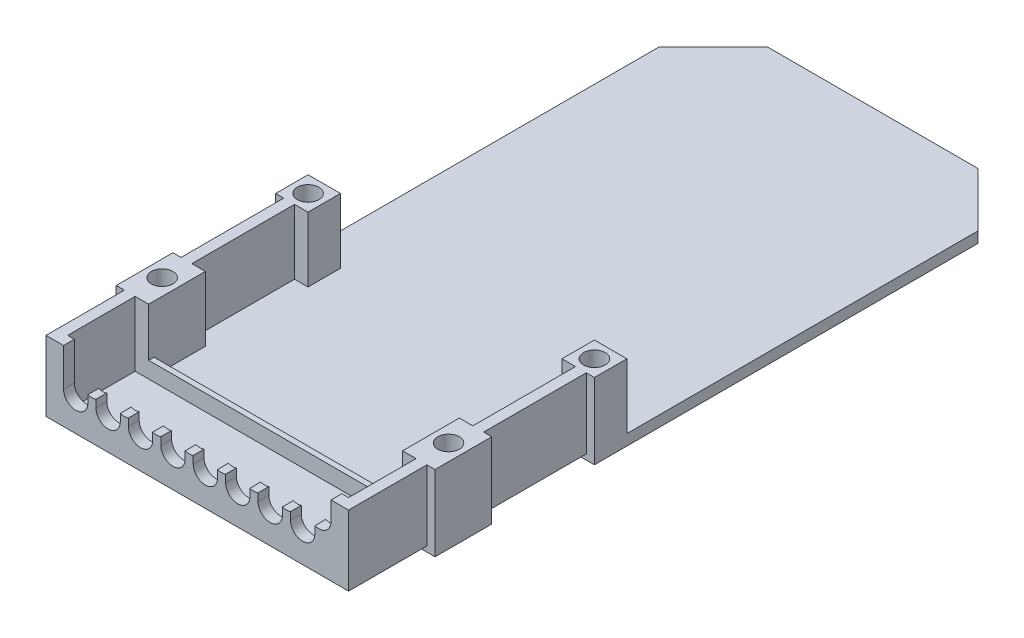
from build123d import *

# Parameters (mm, degrees)
SKETCH1_W            = 56
SKETCH1_H            = 25
BOSS_EXTRUDE1_DEPTH  = 2
SKETCH2_W            = 2
SKETCH2_H            = 25
BOSS_EXTRUDE2_DEPTH  = 12
SKETCH3_W            = 56
SKETCH3_H            = 2
BOSS_EXTRUDE3_DEPTH  = 25
SKETCH4_W            = 6
SKETCH4_H            = 12
BOSS_EXTRUDE4_DEPTH  = 2.5
SKETCH5_W            = 6
SKETCH5_H            = 12
BOSS_EXTRUDE5_DEPTH  = 2.5
SKETCH6_W            = 2
SKETCH6_H            = 12
BOSS_EXTRUDE6_DEPTH  = 25
SKETCH7_W            = 2
SKETCH7_H            = 12
BOSS_EXTRUDE7_DEPTH  = 25
SKETCH8_W            = 2
SKETCH8_H            = 12
BOSS_EXTRUDE8_DEPTH  = 2.5
SKETCH9_W            = 2
SKETCH9_H            = 12
BOSS_EXTRUDE9_DEPTH  = 2.5
SKETCH10_W           = 52
SKETCH10_H           = 1
BOSS_EXTRUDE10_DEPTH = 3
SKETCH11_W           = 52
SKETCH11_H           = 2
BOSS_EXTRUDE11_DEPTH = 12
CUT_EXTRUDE1_DEPTH   = 12
SKETCH13_W           = 6
SKETCH13_H           = 14
BOSS_EXTRUDE12_DEPTH = 1.5
SKETCH14_W           = 6
SKETCH14_H           = 14
BOSS_EXTRUDE13_DEPTH = 1.5
SKETCH15_R           = 2
CUT_EXTRUDE2_DEPTH   = 21.5
SKETCH16_R           = 2
CUT_EXTRUDE3_DEPTH   = 21.5
SKETCH17_W           = 8.5
SKETCH17_H           = 12
BOSS_EXTRUDE14_DEPTH = 2.5
SKETCH18_W           = 8.5
SKETCH18_H           = 12
BOSS_EXTRUDE15_DEPTH = 2.5
SKETCH19_W           = 10.5
SKETCH19_H           = 14
BOSS_EXTRUDE16_DEPTH = 1.5
SKETCH20_W           = 10.5
SKETCH20_H           = 14
BOSS_EXTRUDE17_DEPTH = 1.5
SKETCH21_R           = 2
CUT_EXTRUDE4_DEPTH   = 20
SKETCH22_R           = 2
CUT_EXTRUDE5_DEPTH   = 20
CHAMFER4_SIZE        = 1
SKETCH23_W           = 59
SKETCH23_H           = 2
BOSS_EXTRUDE18_DEPTH = 75
CHAMFER5_SIZE        = 10


with BuildPart() as part:
    # Sketch1 → Boss-Extrude1 (new body)
    with BuildSketch(Plane(origin=(0, 0, 0), x_dir=(1, 0, 0), z_dir=(0, 1, 0))):
        Rectangle(SKETCH1_W, SKETCH1_H)
    extrude(amount=BOSS_EXTRUDE1_DEPTH)

    # Sketch2 → Boss-Extrude2 (add)
    with BuildSketch(Plane(origin=(0, 2, 0), x_dir=(1, 0, 0), z_dir=(0, 1, 0))):
        with Locations((-27, 0)):
            Rectangle(SKETCH2_W, SKETCH2_H)
        with Locations((27, 0)):
            Rectangle(SKETCH2_W, SKETCH2_H)
    extrude(amount=BOSS_EXTRUDE2_DEPTH)

    # Sketch3 → Boss-Extrude3 (add)
    with BuildSketch(Plane.XY.offset(12.5)):
        with Locations((0, 1)):
            Rectangle(SKETCH3_W, SKETCH3_H)
    extrude(amount=BOSS_EXTRUDE3_DEPTH)

    # Sketch4 → Boss-Extrude4 (add)
    with BuildSketch(Plane(origin=(-26, 0, 0), x_dir=(0, 0, -1), z_dir=(1, 0, 0))):
        with Locations((9.5, 8)):
            Rectangle(SKETCH4_W, SKETCH4_H)
    extrude(amount=BOSS_EXTRUDE4_DEPTH)

    # Sketch5 → Boss-Extrude5 (add)
    with BuildSketch(Plane.ZY.offset(-26)):
        with Locations((-9.5, 8)):
            Rectangle(SKETCH5_W, SKETCH5_H)
    extrude(amount=BOSS_EXTRUDE5_DEPTH)

    # Sketch6 → Boss-Extrude6 (add)
    with BuildSketch(Plane.XY.offset(12.5)):
        with Locations((-27, 8)):
            Rectangle(SKETCH6_W, SKETCH6_H)
    extrude(amount=BOSS_EXTRUDE6_DEPTH)

    # Sketch7 → Boss-Extrude7 (add)
    with BuildSketch(Plane.XY.offset(12.5)):
        with Locations((27, 8)):
            Rectangle(SKETCH7_W, SKETCH7_H)
    extrude(amount=BOSS_EXTRUDE7_DEPTH)

    # Sketch8 → Boss-Extrude8 (add)
    with BuildSketch(Plane(origin=(-26, 0, 0), x_dir=(0, 0, -1), z_dir=(1, 0, 0))):
        with Locations((-13.5, 8)):
            Rectangle(SKETCH8_W, SKETCH8_H)
    extrude(amount=BOSS_EXTRUDE8_DEPTH)

    # Sketch9 → Boss-Extrude9 (add)
    with BuildSketch(Plane.ZY.offset(-26)):
        with Locations((13.5, 8)):
            Rectangle(SKETCH9_W, SKETCH9_H)
    extrude(amount=BOSS_EXTRUDE9_DEPTH)

    # Sketch10 → Boss-Extrude10 (add)
    with BuildSketch(Plane(origin=(0, 2, 0), x_dir=(1, 0, 0), z_dir=(0, 1, 0))):
        with Locations((0, -22.5)):
            Rectangle(SKETCH10_W, SKETCH10_H)
    extrude(amount=BOSS_EXTRUDE10_DEPTH)

    # Sketch11 → Boss-Extrude11 (add)
    with BuildSketch(Plane(origin=(0, 2, 0), x_dir=(1, 0, 0), z_dir=(0, 1, 0))):
        with Locations((0, -36.5)):
            Rectangle(SKETCH11_W, SKETCH11_H)
    extrude(amount=BOSS_EXTRUDE11_DEPTH)

    # Sketch12 → Cut-Extrude1 (cut)
    with BuildSketch(Plane.XY.offset(37.5)):
        with BuildLine():
            Line((-24.75, 14), (-24.75, 7))
            ThreePointArc((-24.75, 7), (-22.5, 4.75), (-20.25, 7))
            Line((-20.25, 7), (-20.25, 8.378679656))
            ThreePointArc((-20.25, 8.378679656), (-19.5, 8.25), (-18.75, 8.378679656))
            Line((-18.75, 8.378679656), (-18.75, 7))
            ThreePointArc((-18.75, 7), (-16.5, 4.75), (-14.25, 7))
            Line((-14.25, 7), (-14.25, 8.378679656))
            ThreePointArc((-14.25, 8.378679656), (-13.5, 8.25), (-12.75, 8.378679656))
            Line((-12.75, 8.378679656), (-12.75, 7))
            ThreePointArc((-12.75, 7), (-10.5, 4.75), (-8.25, 7))
            Line((-8.25, 7), (-8.25, 8.378679656))
            ThreePointArc((-8.25, 8.378679656), (-7.5, 8.25), (-6.75, 8.378679656))
            Line((-6.75, 8.378679656), (-6.75, 7))
            ThreePointArc((-6.75, 7), (-4.5, 4.75), (-2.25, 7))
            Line((-2.25, 7), (-2.25, 8.378679656))
            ThreePointArc((-2.25, 8.378679656), (-1.5, 8.25), (-0.75, 8.378679656))
            Line((-0.75, 8.378679656), (-0.75, 7))
            ThreePointArc((-0.75, 7), (1.5, 4.75), (3.75, 7))
            Line((3.75, 7), (3.75, 8.378679656))
            ThreePointArc((3.75, 8.378679656), (4.5, 8.25), (5.25, 8.378679656))
            Line((5.25, 8.378679656), (5.25, 7))
            ThreePointArc((5.25, 7), (7.5, 4.75), (9.75, 7))
            Line((9.75, 7), (9.75, 8.378679656))
            ThreePointArc((9.75, 8.378679656), (10.5, 8.25), (11.25, 8.378679656))
            Line((11.25, 8.378679656), (11.25, 7))
            ThreePointArc((11.25, 7), (13.5, 4.75), (15.75, 7))
            Line((15.75, 7), (15.75, 8.378679656))
            ThreePointArc((15.75, 8.378679656), (16.5, 8.25), (17.25, 8.378679656))
            Line((17.25, 8.378679656), (17.25, 7))
            ThreePointArc((17.25, 7), (19.5, 4.75), (21.75, 7))
            Line((21.75, 7), (21.75, 8.378679656))
            ThreePointArc((21.75, 8.378679656), (23.799038106, 8.662882693), (24.75, 10.5))
            Line((24.75, 10.5), (24.75, 14))
            Line((24.75, 14), (-24.75, 14))
        make_face()
    extrude(amount=-CUT_EXTRUDE1_DEPTH, mode=Mode.SUBTRACT)

    # Sketch13 → Boss-Extrude12 (add)
    with BuildSketch(Plane.ZY.offset(28)):
        with Locations((-9.5, 7)):
            Rectangle(SKETCH13_W, SKETCH13_H)
    extrude(amount=BOSS_EXTRUDE12_DEPTH)

    # Sketch14 → Boss-Extrude13 (add)
    with BuildSketch(Plane(origin=(28, 0, 0), x_dir=(0, 0, -1), z_dir=(1, 0, 0))):
        with Locations((9.5, 7)):
            Rectangle(SKETCH14_W, SKETCH14_H)
    extrude(amount=BOSS_EXTRUDE13_DEPTH)

    # Sketch15 → Cut-Extrude2 (cut)
    with BuildSketch(Plane(origin=(0, 14, 0), x_dir=(1, 0, 0), z_dir=(0, 1, 0))):
        with Locations((-26.5, 9.5)):
            Circle(SKETCH15_R)
    extrude(amount=-CUT_EXTRUDE2_DEPTH, mode=Mode.SUBTRACT)

    # Sketch16 → Cut-Extrude3 (cut)
    with BuildSketch(Plane(origin=(0, 14, 0), x_dir=(1, 0, 0), z_dir=(0, 1, 0))):
        with Locations((26.5, 9.5)):
            Circle(SKETCH16_R)
    extrude(amount=-CUT_EXTRUDE3_DEPTH, mode=Mode.SUBTRACT)

    # Sketch17 → Boss-Extrude14 (add)
    with BuildSketch(Plane.ZY.offset(-26)):
        with Locations((18.75, 8)):
            Rectangle(SKETCH17_W, SKETCH17_H)
    extrude(amount=BOSS_EXTRUDE14_DEPTH)

    # Sketch18 → Boss-Extrude15 (add)
    with BuildSketch(Plane(origin=(-26, 0, 0), x_dir=(0, 0, -1), z_dir=(1, 0, 0))):
        with Locations((-18.75, 8)):
            Rectangle(SKETCH18_W, SKETCH18_H)
    extrude(amount=BOSS_EXTRUDE15_DEPTH)

    # Sketch19 → Boss-Extrude16 (add)
    with BuildSketch(Plane(origin=(28, 0, 0), x_dir=(0, 0, -1), z_dir=(1, 0, 0))):
        with Locations((-17.75, 7)):
            Rectangle(SKETCH19_W, SKETCH19_H)
    extrude(amount=BOSS_EXTRUDE16_DEPTH)

    # Sketch20 → Boss-Extrude17 (add)
    with BuildSketch(Plane.ZY.offset(28)):
        with Locations((17.75, 7)):
            Rectangle(SKETCH20_W, SKETCH20_H)
    extrude(amount=BOSS_EXTRUDE17_DEPTH)

    # Sketch21 → Cut-Extrude4 (cut)
    with BuildSketch(Plane(origin=(0, 14, 0), x_dir=(1, 0, 0), z_dir=(0, 1, 0))):
        with Locations((26.5, -17.5)):
            Circle(SKETCH21_R)
    extrude(amount=-CUT_EXTRUDE4_DEPTH, mode=Mode.SUBTRACT)

    # Sketch22 → Cut-Extrude5 (cut)
    with BuildSketch(Plane(origin=(0, 14, 0), x_dir=(1, 0, 0), z_dir=(0, 1, 0))):
        with Locations((-26.5, -17.5)):
            Circle(SKETCH22_R)
    extrude(amount=-CUT_EXTRUDE5_DEPTH, mode=Mode.SUBTRACT)

    # Chamfer4
    chamfer4_edges = [part.edges().sort_by_distance(p)[0] for p in [
        (28, 0, 3),
        (28, 0, 30.25),
        (0, 0, 37.5),
        (-28, 0, 30.25),
        (-28, 0, 3),
    ]]
    chamfer(chamfer4_edges, length=CHAMFER4_SIZE)

    # Sketch23 → Boss-Extrude18 (add)
    with BuildSketch(Plane(origin=(0, 0, -12.5), x_dir=(-1, 0, 0), z_dir=(0, 0, -1))):
        with Locations((0, 1)):
            Rectangle(SKETCH23_W, SKETCH23_H)
    extrude(amount=BOSS_EXTRUDE18_DEPTH)

    # Chamfer5
    chamfer5_edges = [part.edges().sort_by_distance(p)[0] for p in [
        (-29.5, 1, -87.5),
        (29.5, 1, -87.5),
    ]]
    chamfer(chamfer5_edges, length=CHAMFER5_SIZE)


solid = part.part
